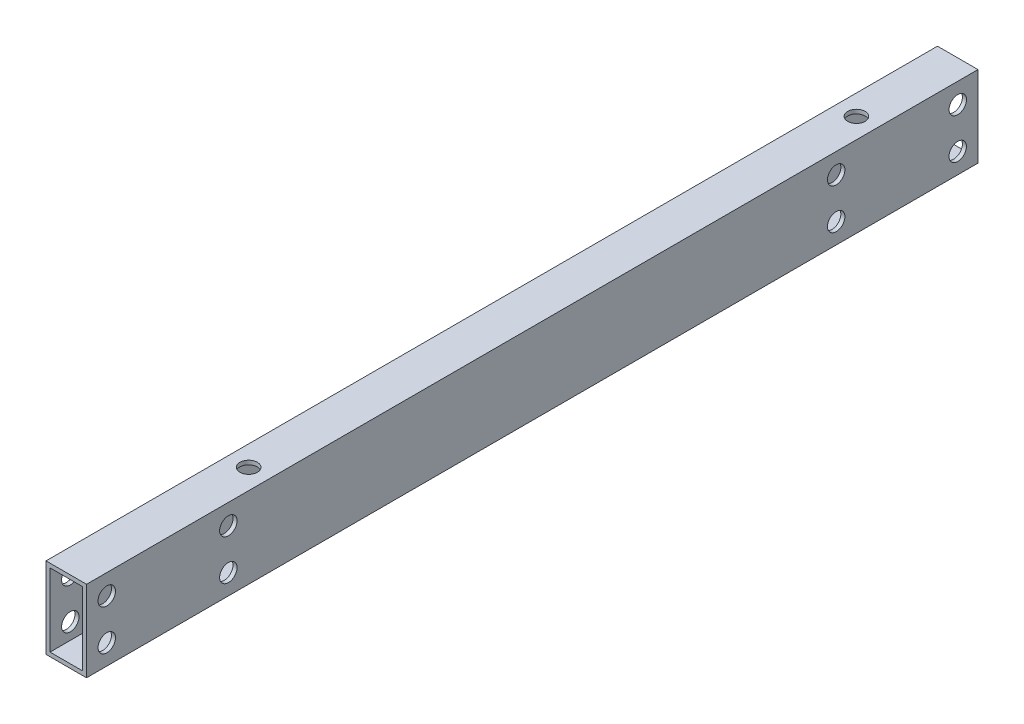
from build123d import *

# Parameters (mm, degrees)
SKETCH_1_W          = 10
SKETCH_1_H          = 20
SKETCH_1_W_2        = 8
SKETCH_1_H_2        = 18
EXTRUDE_1_DEPTH     = 220
SKETCH_2_R          = 2.15
CUT_EXTRUDE_1_DEPTH = 221.45407685
SKETCH_3_R          = 2.15
CUT_EXTRUDE_2_DEPTH = 221.96379794


with BuildPart() as part:
    # ｽｹｯﾁ1 → 押し出し-薄板1 (new body)
    with BuildSketch(Plane.XY):
        Rectangle(SKETCH_1_W, SKETCH_1_H)
        Rectangle(SKETCH_1_W_2, SKETCH_1_H_2, mode=Mode.SUBTRACT)
    extrude(amount=EXTRUDE_1_DEPTH)

    # ｽｹｯﾁ2 → ｶｯﾄ - 押し出し1 (cut, through all)
    with BuildSketch(Plane(origin=(5, 0, 0), x_dir=(0, 0, -1), z_dir=(1, 0, 0))):
        with Locations((-5, 5)):
            Circle(SKETCH_2_R)
        with Locations((-5, -5)):
            Circle(SKETCH_2_R)
        with Locations((-35, 5)):
            Circle(SKETCH_2_R)
        with Locations((-35, -5)):
            Circle(SKETCH_2_R)
        with Locations((-185, -5)):
            Circle(SKETCH_2_R)
        with Locations((-185, 5)):
            Circle(SKETCH_2_R)
        with Locations((-215, -5)):
            Circle(SKETCH_2_R)
        with Locations((-215, 5)):
            Circle(SKETCH_2_R)
    extrude(amount=-CUT_EXTRUDE_1_DEPTH, mode=Mode.SUBTRACT)

    # ｽｹｯﾁ3 → ｶｯﾄ - 押し出し2 (cut, through all)
    with BuildSketch(Plane(origin=(0, 10, 0), x_dir=(1, 0, 0), z_dir=(0, 1, 0))):
        with Locations((0, -25)):
            Circle(SKETCH_3_R)
        with Locations((0, -175)):
            Circle(SKETCH_3_R)
    extrude(amount=-CUT_EXTRUDE_2_DEPTH, mode=Mode.SUBTRACT)


solid = part.part
